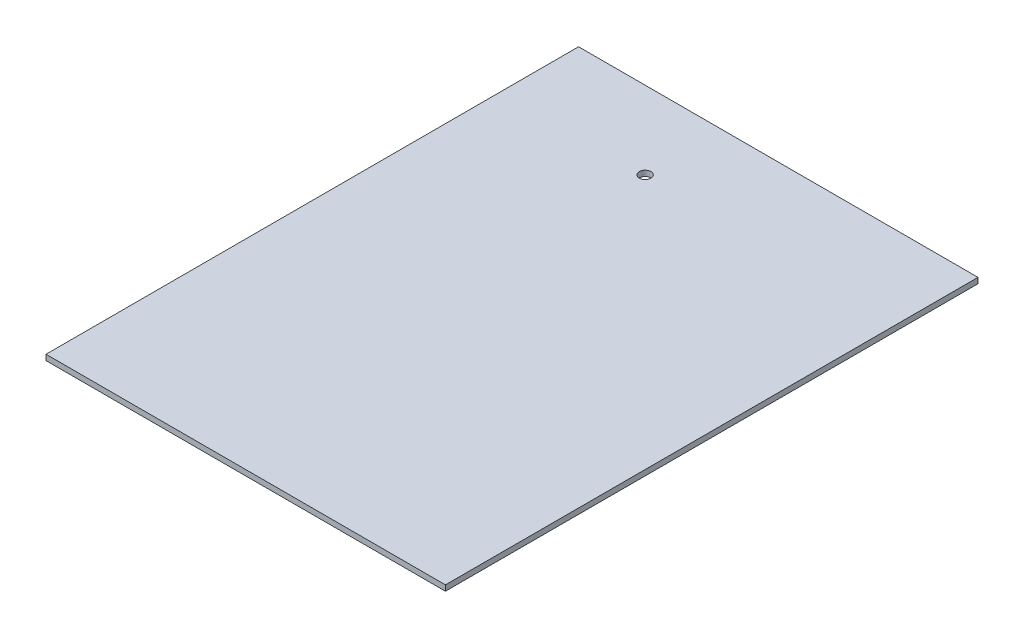
from build123d import *

# Parameters (mm, degrees)
SKETCH1_W           = 457.2
SKETCH1_H           = 609.6
BOSS_EXTRUDE1_DEPTH = 6.35
SKETCH2_R           = 6.604
CUT_EXTRUDE2_DEPTH  = 763.026457874


with BuildPart() as part:
    # Sketch1 → Boss-Extrude1 (new body)
    with BuildSketch(Plane(origin=(0, 0, 0), x_dir=(1, 0, 0), z_dir=(0, 1, 0))):
        with Locations((-228.6, 304.8)):
            Rectangle(SKETCH1_W, SKETCH1_H)
    extrude(amount=BOSS_EXTRUDE1_DEPTH)

    # Sketch2 → Cut-Extrude2 (cut, through all)
    with BuildSketch(Plane(origin=(0, 6.35, 0), x_dir=(1, 0, 0), z_dir=(0, 1, 0))):
        with Locations((-292.1, 520.7)):
            Circle(SKETCH2_R)
    extrude(amount=-CUT_EXTRUDE2_DEPTH, mode=Mode.SUBTRACT)


solid = part.part
